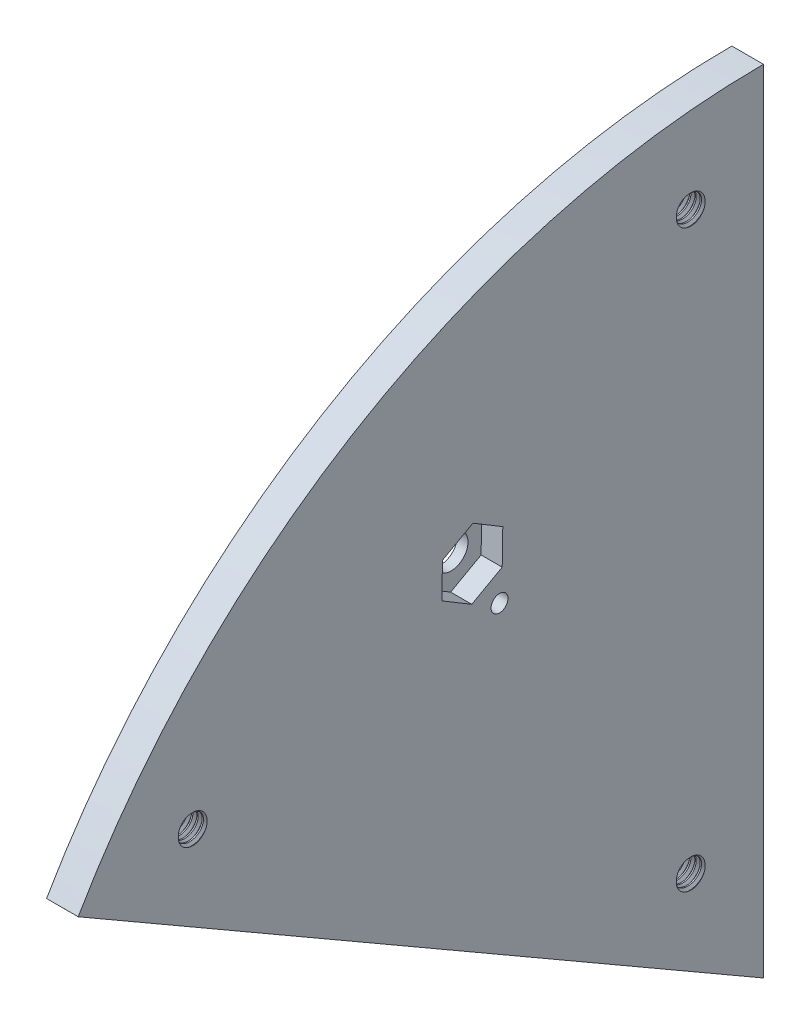
from build123d import *

# Parameters (mm, degrees)
SKETCH1_W                 = 6
SKETCH1_H                 = 150
REVOLVE_THIN1_ANGLE       = 60
SKETCH4_R                 = 1.6
CUT_EXTRUDE1_DEPTH        = 6
SKETCH6_R                 = 3.175
CUT_EXTRUDE2_DEPTH        = 6
CUT_EXTRUDE3_DEPTH        = 4
M6X1_0_TAPPED_HOLE1_D     = 5
M6X1_0_TAPPED_HOLE1_DEPTH = 15
M6X1_0_TAPPED_HOLE1_TIP   = 1.502151548
THREAD1_PITCH             = 1
THREAD2_PITCH             = 1
THREAD3_PITCH             = 1


with BuildPart() as part:
    # Sketch1 → Revolve-Thin1 (revolve)
    with BuildSketch(Plane.XY):
        with Locations((3, 75)):
            Rectangle(SKETCH1_W, SKETCH1_H)
    revolve(axis=Axis((-55.12605431, 0, 0), (1, 0, 0)), revolution_arc=REVOLVE_THIN1_ANGLE)

    # Sketch4 → Cut-Extrude1 (cut)
    with BuildSketch(Plane(origin=(6, 0, 0), x_dir=(0, 0, -1), z_dir=(1, 0, 0))):
        with Locations((-50.0315795, 86.547867527)):
            Circle(SKETCH4_R)
    extrude(amount=-CUT_EXTRUDE1_DEPTH, mode=Mode.SUBTRACT)

    # Sketch6 → Cut-Extrude2 (cut)
    with BuildSketch(Plane(origin=(6, 0, 0), x_dir=(0, 0, -1), z_dir=(1, 0, 0))):
        with Locations((-55.189389478, 95.600462796)):
            Circle(SKETCH6_R)
    extrude(amount=-CUT_EXTRUDE2_DEPTH, mode=Mode.SUBTRACT)

    # Sketch7 → Cut-Extrude3 (cut)
    with BuildSketch(Plane(origin=(6, 0, 0), x_dir=(0, 0, -1), z_dir=(1, 0, 0))):
        Polygon((-60.963191535, 92.392560362), (-55.298165506, 88.996252321), (-49.524363449, 92.204154754), (-49.41558742, 98.808365229), (-55.080613449, 102.20467327), (-60.854415506, 98.996770837), align=None)
    extrude(amount=-CUT_EXTRUDE3_DEPTH, mode=Mode.SUBTRACT)

    # M6x1.0 Tapped Hole1
    with Locations(Plane(origin=(6, 0, 0), x_dir=(0, 0, -1), z_dir=(1, 0, 0))):
        with Locations((-14, 133.266649992), (-108.41226828, 78.757659812), (-14, 24.248711306)):
            Hole(M6X1_0_TAPPED_HOLE1_D / 2, depth=M6X1_0_TAPPED_HOLE1_DEPTH)
            with Locations((0, 0, -(M6X1_0_TAPPED_HOLE1_DEPTH + M6X1_0_TAPPED_HOLE1_TIP / 2))):  # 118° drill point
                Cone(0, M6X1_0_TAPPED_HOLE1_D / 2, M6X1_0_TAPPED_HOLE1_TIP, mode=Mode.SUBTRACT)

    # Thread1: arcs per turn and ends read off the stored shape
    # Thread1: the profile of Thread Profile2 profile screwed along a right-hand helix through 10 turns, 8 arcs to a turn; built about Z, then put on its axis
    thread1_z = Axis((0, 0, 0), (0, 0, 1))
    thread1_corners = [(2.4997, 0, -0.000173205), (3.041265875, 0, 0.312499999), (3.041265875, 0, 0.437499999), (2.4997, 0, 0.750173202)]
    with BuildLine(mode=Mode.PRIVATE) as thread1_profile:
        Line(thread1_corners[0], thread1_corners[1])
        Line(thread1_corners[1], thread1_corners[2])
        Line(thread1_corners[2], thread1_corners[3])
        Line(thread1_corners[3], thread1_corners[0])
    thread1_cap = Face(thread1_profile.wire())
    thread1_turn_angles = [0, 22.5, 45, 67.5, 90, 112.5, 135, 157.5, 180, 202.5, 225, 247.5, 270, 292.5, 315, 337.5, 360]
    thread1_turn_weights = [1, 0.9238795325112867, 1, 0.9238795325112867, 1, 0.9238795325112867, 1, 0.9238795325112867, 1, 0.9238795325112867, 1, 0.9238795325112867, 1, 0.9238795325112867, 1, 0.9238795325112867, 1]
    thread1_turn_rails = [Edge.make_bspline([Vector(p[0], p[1], 0).rotate(thread1_z, thread1_turn_angles[k]) / thread1_turn_weights[k] + Vector(0, 0, p[2] + THREAD1_PITCH * thread1_turn_angles[k] / 360) for k in range(17)], [0, 0, 0, 1, 1, 2, 2, 3, 3, 4, 4, 5, 5, 6, 6, 7, 7, 8, 8, 8], 2, thread1_turn_weights) for p in thread1_corners]
    thread1_turn_sides = [Face.make_surface_from_curves(thread1_turn_rails[p[0]], thread1_turn_rails[p[1]]) for p in [(0, 1), (1, 2), (2, 3), (3, 0)]]
    thread1 = Plane(origin=(7, 78.757659812, 108.41226828), x_dir=(0, 0, 1), z_dir=(-1, 0, 0)) * Solid(Shell([*[p.moved(Location((0, 0, THREAD1_PITCH * i))) for i in range(10) for p in thread1_turn_sides], thread1_cap, thread1_cap.rotate(thread1_z, 3600).moved(Location((0, 0, THREAD1_PITCH * 3600 / 360)))]))
    add(thread1, mode=Mode.SUBTRACT)

    # Thread2: arcs per turn and ends read off the stored shape
    # Thread2: the profile of Thread Profile3 profile screwed along a right-hand helix through 10 turns, 8 arcs to a turn; built about Z, then put on its axis
    thread2_z = Axis((0, 0, 0), (0, 0, 1))
    thread2_corners = [(2.4997, 0, -0.000173205), (3.041265875, 0, 0.312499999), (3.041265875, 0, 0.437499999), (2.4997, 0, 0.750173202)]
    with BuildLine(mode=Mode.PRIVATE) as thread2_profile:
        Line(thread2_corners[0], thread2_corners[1])
        Line(thread2_corners[1], thread2_corners[2])
        Line(thread2_corners[2], thread2_corners[3])
        Line(thread2_corners[3], thread2_corners[0])
    thread2_cap = Face(thread2_profile.wire())
    thread2_turn_angles = [0, 22.5, 45, 67.5, 90, 112.5, 135, 157.5, 180, 202.5, 225, 247.5, 270, 292.5, 315, 337.5, 360]
    thread2_turn_weights = [1, 0.9238795325112867, 1, 0.9238795325112867, 1, 0.9238795325112867, 1, 0.9238795325112867, 1, 0.9238795325112867, 1, 0.9238795325112867, 1, 0.9238795325112867, 1, 0.9238795325112867, 1]
    thread2_turn_rails = [Edge.make_bspline([Vector(p[0], p[1], 0).rotate(thread2_z, thread2_turn_angles[k]) / thread2_turn_weights[k] + Vector(0, 0, p[2] + THREAD2_PITCH * thread2_turn_angles[k] / 360) for k in range(17)], [0, 0, 0, 1, 1, 2, 2, 3, 3, 4, 4, 5, 5, 6, 6, 7, 7, 8, 8, 8], 2, thread2_turn_weights) for p in thread2_corners]
    thread2_turn_sides = [Face.make_surface_from_curves(thread2_turn_rails[p[0]], thread2_turn_rails[p[1]]) for p in [(0, 1), (1, 2), (2, 3), (3, 0)]]
    thread2 = Plane(origin=(7, 133.266649992, 14), x_dir=(0, 0, 1), z_dir=(-1, 0, 0)) * Solid(Shell([*[p.moved(Location((0, 0, THREAD2_PITCH * i))) for i in range(10) for p in thread2_turn_sides], thread2_cap, thread2_cap.rotate(thread2_z, 3600).moved(Location((0, 0, THREAD2_PITCH * 3600 / 360)))]))
    add(thread2, mode=Mode.SUBTRACT)

    # Thread3: arcs per turn and ends read off the stored shape
    # Thread3: the profile of Thread Profile4 profile screwed along a right-hand helix through 10 turns, 8 arcs to a turn; built about Z, then put on its axis
    thread3_z = Axis((0, 0, 0), (0, 0, 1))
    thread3_corners = [(2.4997, 0, -0.000173205), (3.041265875, 0, 0.312499999), (3.041265875, 0, 0.437499999), (2.4997, 0, 0.750173202)]
    with BuildLine(mode=Mode.PRIVATE) as thread3_profile:
        Line(thread3_corners[0], thread3_corners[1])
        Line(thread3_corners[1], thread3_corners[2])
        Line(thread3_corners[2], thread3_corners[3])
        Line(thread3_corners[3], thread3_corners[0])
    thread3_cap = Face(thread3_profile.wire())
    thread3_turn_angles = [0, 22.5, 45, 67.5, 90, 112.5, 135, 157.5, 180, 202.5, 225, 247.5, 270, 292.5, 315, 337.5, 360]
    thread3_turn_weights = [1, 0.9238795325112867, 1, 0.9238795325112867, 1, 0.9238795325112867, 1, 0.9238795325112867, 1, 0.9238795325112867, 1, 0.9238795325112867, 1, 0.9238795325112867, 1, 0.9238795325112867, 1]
    thread3_turn_rails = [Edge.make_bspline([Vector(p[0], p[1], 0).rotate(thread3_z, thread3_turn_angles[k]) / thread3_turn_weights[k] + Vector(0, 0, p[2] + THREAD3_PITCH * thread3_turn_angles[k] / 360) for k in range(17)], [0, 0, 0, 1, 1, 2, 2, 3, 3, 4, 4, 5, 5, 6, 6, 7, 7, 8, 8, 8], 2, thread3_turn_weights) for p in thread3_corners]
    thread3_turn_sides = [Face.make_surface_from_curves(thread3_turn_rails[p[0]], thread3_turn_rails[p[1]]) for p in [(0, 1), (1, 2), (2, 3), (3, 0)]]
    thread3 = Plane(origin=(7, 24.248711306, 14), x_dir=(0, 0, 1), z_dir=(-1, 0, 0)) * Solid(Shell([*[p.moved(Location((0, 0, THREAD3_PITCH * i))) for i in range(10) for p in thread3_turn_sides], thread3_cap, thread3_cap.rotate(thread3_z, 3600).moved(Location((0, 0, THREAD3_PITCH * 3600 / 360)))]))
    add(thread3, mode=Mode.SUBTRACT)


solid = part.part
